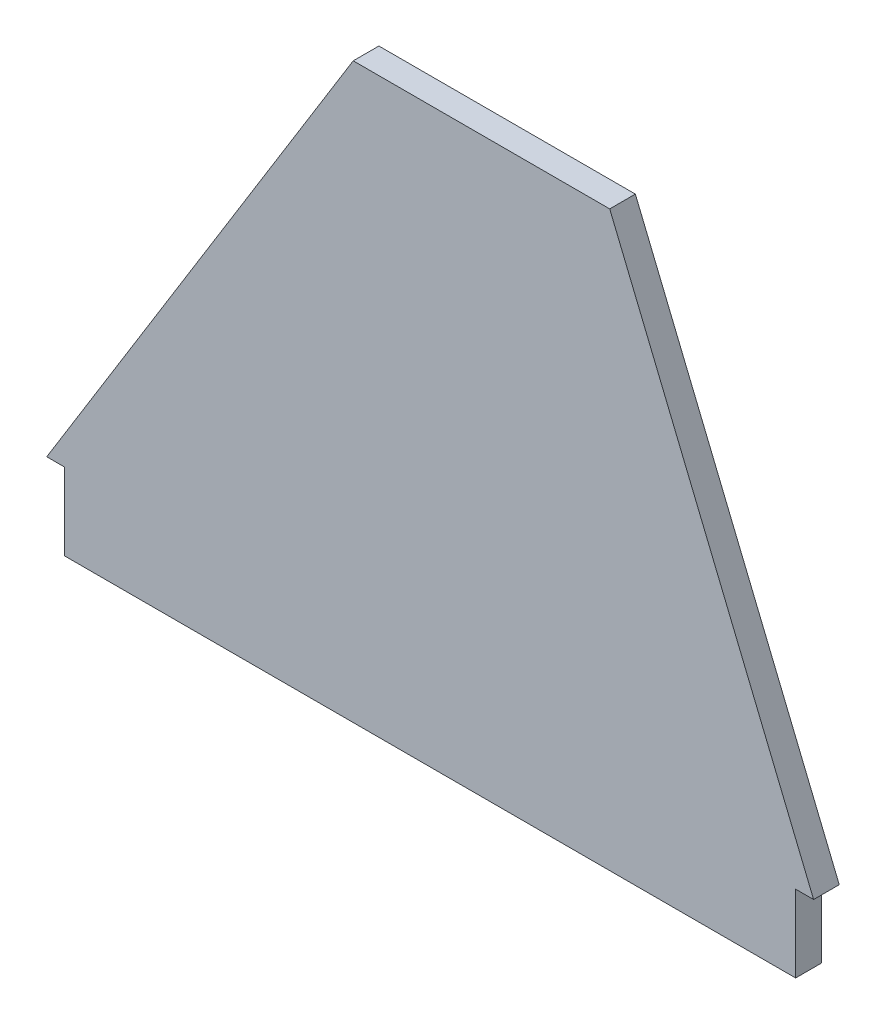
from build123d import *

# Parameters (mm, degrees)
BOSS_EXTRUDE1_DEPTH = 5


with BuildPart() as part:
    # Sketch1 → Boss-Extrude1 (new body)
    with BuildSketch(Plane.XY):
        Polygon((74.75, 15), (71.25, 15), (71.25, 0), (-71.25, 0), (-71.25, 15), (-74.75, 15), (-15, 111.725913897), (0, 111.725913897), (35, 111.725913897), align=None)
    extrude(amount=BOSS_EXTRUDE1_DEPTH)


solid = part.part
